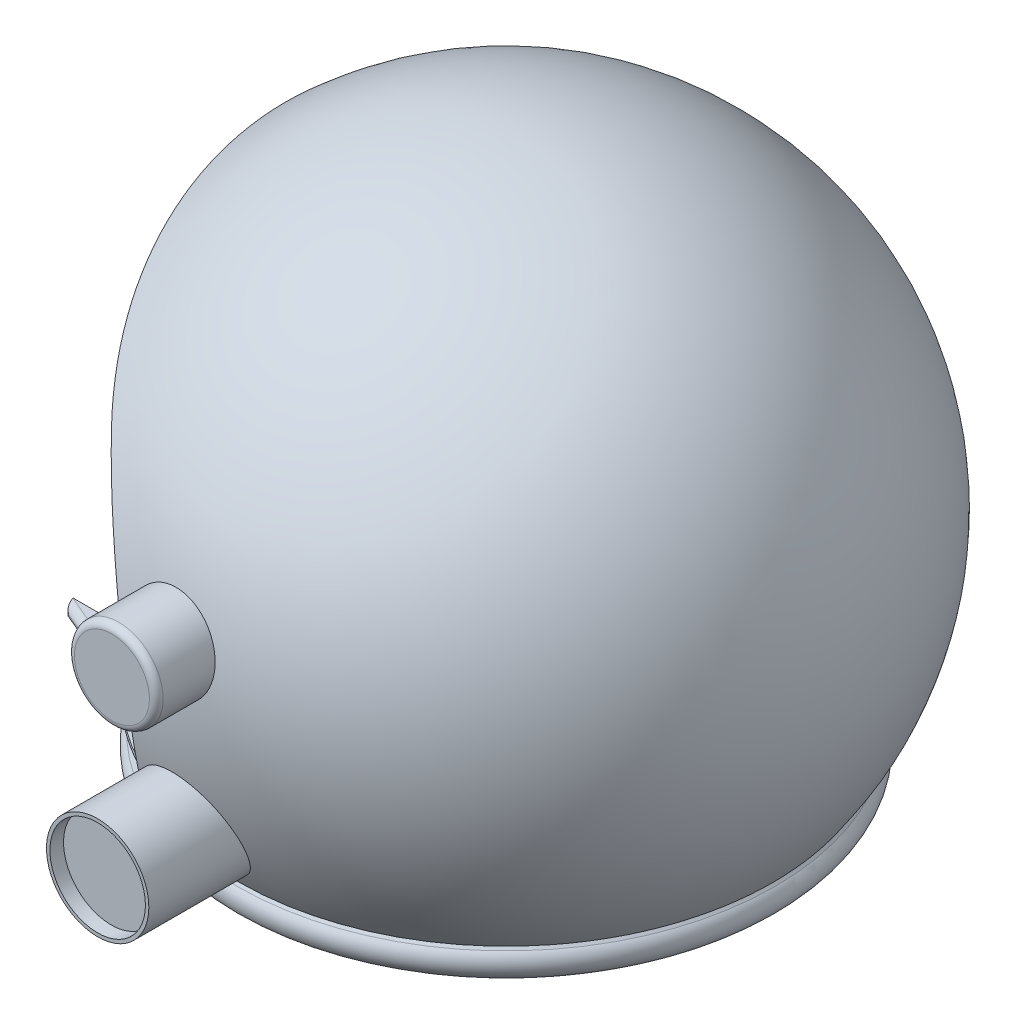
from build123d import *

# Parameters (mm, degrees)
CUT_EXTRUDE1_DEPTH       = 84.138438763
CUT_EXTRUDE1_DEPTH_BACK  = 84.138438763
SKETCH4_R                = 37.5
CUT_EXTRUDE2_DEPTH       = 30
BOSS_EXTRUDE1_DEPTH      = 10
BOSS_EXTRUDE1_DEPTH_BACK = 7
SKETCH8_R                = 7.5
SKETCH9_R                = 7
CUT_EXTRUDE3_DEPTH       = 2
SKETCH10_R               = 6.5
BOSS_EXTRUDE2_DEPTH      = 16
BOSS_EXTRUDE3_DEPTH      = 1
BOSS_EXTRUDE3_DEPTH_BACK = 1
FILLET1_R                = 1
FILLET2_R                = 1


with BuildPart() as part:
    # Sketch1 → Revolve2 (revolve)
    with BuildSketch(Plane.XY, mode=Mode.PRIVATE) as revolve2_sk:
        with BuildLine():
            Line((-32.314045232, 35.493696352), (-30.294417405, 33.27534033))
            ThreePointArc((-30.294417405, 33.27534033), (15.527182125, 42.236318676), (44.633727032, 5.729782823))
            Line((44.633727032, 5.729782823), (47.609308835, 6.111768345))
            ThreePointArc((47.609308835, 6.111768345), (16.5623276, 45.052073254), (-32.314045232, 35.493696352))
        make_face()
    revolve(revolve2_sk.sketch.rotate(Axis((44.633727032, 5.729782823, 0), (0.9918606007187919, 0.12732850718420158, 0)), 180), axis=Axis((44.633727032, 5.729782823, 0), (0.9918606007187919, 0.12732850718420158, 0)))

    # Sketch2 → Cut-Extrude1 (cut, two sides: drawn at the far end of the back side and taken through both)
    with BuildSketch(Plane.XY.offset(-CUT_EXTRUDE1_DEPTH_BACK)):
        with BuildLine():
            Line((-32.314045232, 35.493696352), (-18.855448385, 20.710794787))
            ThreePointArc((-18.855448385, 20.710794787), (-8.759104649, -1.124435952), (-13.012837873, -24.80183471))
            Line((-13.012837873, -24.80183471), (-22.301110165, -42.504828966))
            Line((-22.301110165, -42.504828966), (-32.314045232, 35.493696352))
        make_face()
    extrude(amount=CUT_EXTRUDE1_DEPTH + CUT_EXTRUDE1_DEPTH_BACK, mode=Mode.SUBTRACT)

    # Sketch4 → Cut-Extrude2 (cut)
    with BuildSketch(Plane(origin=(0, -48, 0), x_dir=(1, 0, 0), z_dir=(0, 1, 0))):
        Circle(SKETCH4_R)
    extrude(amount=CUT_EXTRUDE2_DEPTH, mode=Mode.SUBTRACT)

    # Sketch7 → Revolve3 (revolve)
    with BuildSketch(Plane(origin=(0, 0, 0), x_dir=(0, 0, -1), z_dir=(1, 0, 0))):
        with BuildLine():
            Line((-39.878437938, -23.587743123), (-35.145164985, -23.587743123))
            add(Edge.make_bspline(
                [(-35.145164985, -23.587743123), (-37.467015888, -25.630384459), (-35.652834068, -28.277846598)],
                knots=[0, 0, 0, 1, 1, 1], degree=2))
            ThreePointArc((-35.652834068, -28.277846598), (-37.5, -32.462476533), (-39.347165932, -28.277846598))
            add(Edge.make_bspline(
                [(-39.878437938, -23.587743123), (-40.301329239, -25.431274232), (-36.64673771, -24.653176545), (-39.347165932, -28.277846598)],
                knots=[0, 0, 0, 0, 1, 1, 1, 1], degree=3))
        make_face()
    revolve(axis=Axis((0, 0, 0), (0, -1, 0)))

    # Sketch8 → Boss-Extrude1 (add, two sides: drawn at the far end of the back side and taken through both)
    with BuildSketch(Plane.XY.offset(48).offset(-BOSS_EXTRUDE1_DEPTH_BACK)):
        with Locations((-1.874802676, -18.751711843)):
            Circle(SKETCH8_R)
    extrude(amount=BOSS_EXTRUDE1_DEPTH + BOSS_EXTRUDE1_DEPTH_BACK)

    # Sketch9 → Cut-Extrude3 (cut)
    with BuildSketch(Plane.XY.offset(58)):
        with Locations((-1.874802676, -18.751711843)):
            Circle(SKETCH9_R)
    extrude(amount=-CUT_EXTRUDE3_DEPTH, mode=Mode.SUBTRACT)

    # Sketch10 → Boss-Extrude2 (add)
    with BuildSketch(Plane.XY.offset(56)):
        with Locations((-1.785112509, 5.733703861)):
            Circle(SKETCH10_R)
    extrude(amount=-BOSS_EXTRUDE2_DEPTH)

    # Fillet1
    fillet1_edges = [part.edges().sort_by_distance(p)[0] for p in [
        (-8.285112509, 5.733703861, 56),
    ]]
    fillet(fillet1_edges, radius=FILLET1_R)


with BuildPart() as body_2:
    # Sketch13 → Boss-Extrude3 (new, two sides: drawn at the far end of the back side and taken through both)
    with BuildSketch(Plane(origin=(0, 6, 0), x_dir=(1, 0, 0), z_dir=(0, 1, 0)).offset(-BOSS_EXTRUDE3_DEPTH_BACK)):
        Polygon((-8.285112509, -50.047693497), (-13.429116403, -50.047693497), (-13.009463098, -51.348766468), (-8.285112509, -53.341014415), align=None)
    extrude(amount=BOSS_EXTRUDE3_DEPTH + BOSS_EXTRUDE3_DEPTH_BACK)

    # Fillet2
    fillet2_edges = [body_2.edges().sort_by_distance(p)[0] for p in [
        (-10.647287804, 7, 52.344890442),
        (-10.647287804, 5, 52.344890442),
        (-8.285112509, 6, 53.341014415),
        (-13.009463098, 6, 51.348766468),
    ]]
    fillet(fillet2_edges, radius=FILLET2_R - 0.0001)  # a hair under: the kernel refuses the full size


solid = Compound([part.part, body_2.part])
